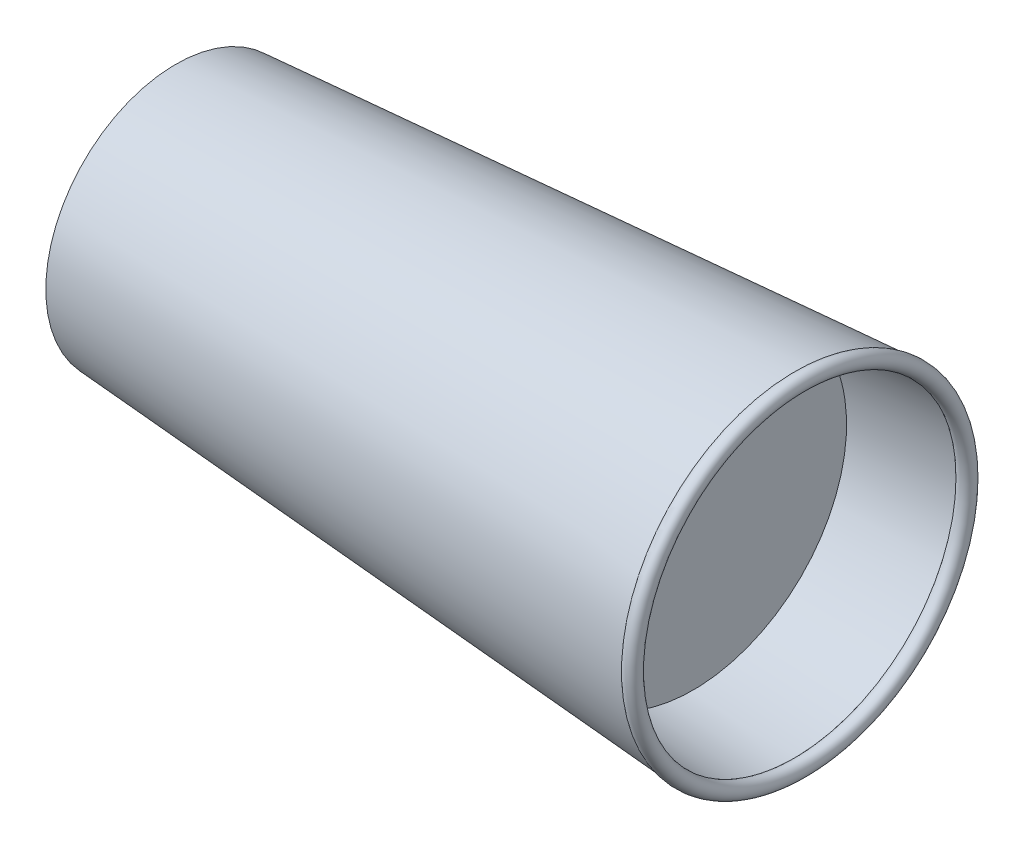
from build123d import *

# Parameters (mm, degrees)
SKETCH1_R           = 31.75
BOSS_EXTRUDE1_DEPTH = 152.4
DRAFT1_ANGLE        = 4
SKETCH3_R           = 29.21
CUT_EXTRUDE1_DEPTH  = 3.175
SHELL2_T            = -2.54
SKETCH4_R           = 1.905


with BuildPart() as part:
    # Sketch1 → Boss-Extrude1 (new body)
    with BuildSketch(Plane(origin=(0, 0, 0), x_dir=(0, 0, -1), z_dir=(1, 0, 0))):
        with Locations(Location((0, 0, 0), (0, 0, 180))):
            Circle(SKETCH1_R)
    extrude(amount=BOSS_EXTRUDE1_DEPTH)

    # Draft1
    draft1_faces = [part.faces().sort_by_distance(p)[0] for p in [
        (76.2, 0, -31.75),
    ]]
    draft(draft1_faces, Plane(origin=(0, 0, 0), x_dir=(0, 0, -1), z_dir=(-1, 0, 0)), DRAFT1_ANGLE)

    # Sketch3 → Cut-Extrude1 (cut)
    with BuildSketch(Plane.ZY):
        Circle(SKETCH3_R)
    extrude(amount=-CUT_EXTRUDE1_DEPTH, mode=Mode.SUBTRACT)

    # Shell2
    shell2_openings = [part.faces().sort_by_distance(p)[0] for p in [
        (152.4, 0, 0),
    ]]
    offset(amount=SHELL2_T, openings=shell2_openings, kind=Kind.INTERSECTION)

    # Sketch4 → Revolve1 (revolve)
    with BuildSketch(Plane(origin=(0, 0, 0), x_dir=(1, 0, 0), z_dir=(0, 1, 0))):
        with Locations((152.4, 40.85216375)):
            Circle(SKETCH4_R)
    revolve(axis=Axis((152.4, 0, 0), (-1, 0, 0)))

    # Loft1: read off the stored shape, not the designer's step
    # Loft1: loft between two sections, ruled curve by curve
    loft1_from = [
        Edge.make_bspline([(5.715, 9.130270928, 28.160276626), (5.715, -47.190282323, 46.420818482), (5.715, -65.45082418, -9.89973477), (5.715, -9.130270928, -28.160276626), (5.715, 47.190282323, -46.420818482), (5.715, 65.45082418, 9.89973477), (5.715, 9.130270928, 28.160276626)], [0, 0, 0, 0, 0.5, 0.5, 0.5, 1, 1, 1, 1], 3, [1, 0.333333333, 0.333333333, 1, 0.333333333, 0.333333333, 1]),
    ]
    loft1_to = [
        Edge.make_bspline([(126.365, -16.699930799, 33.553520927), (126.365, -83.806972652, 0.153659328), (126.365, -50.407111054, -66.953382525), (126.365, 16.699930799, -33.553520927), (126.365, 83.806972652, -0.153659328), (126.365, 50.407111054, 66.953382525), (126.365, -16.699930799, 33.553520927)], [0, 0, 0, 0, 0.5, 0.5, 0.5, 1, 1, 1, 1], 3, [1, 0.333333333, 0.333333333, 1, 0.333333333, 0.333333333, 1]),
    ]
    loft1 = Solid(Shell([*[Face.make_surface_from_curves(loft1_from[k], loft1_to[k]) for k in range(1)], Face(Wire(loft1_from)), Face(Wire(loft1_to))]))
    add(loft1)


solid = part.part
